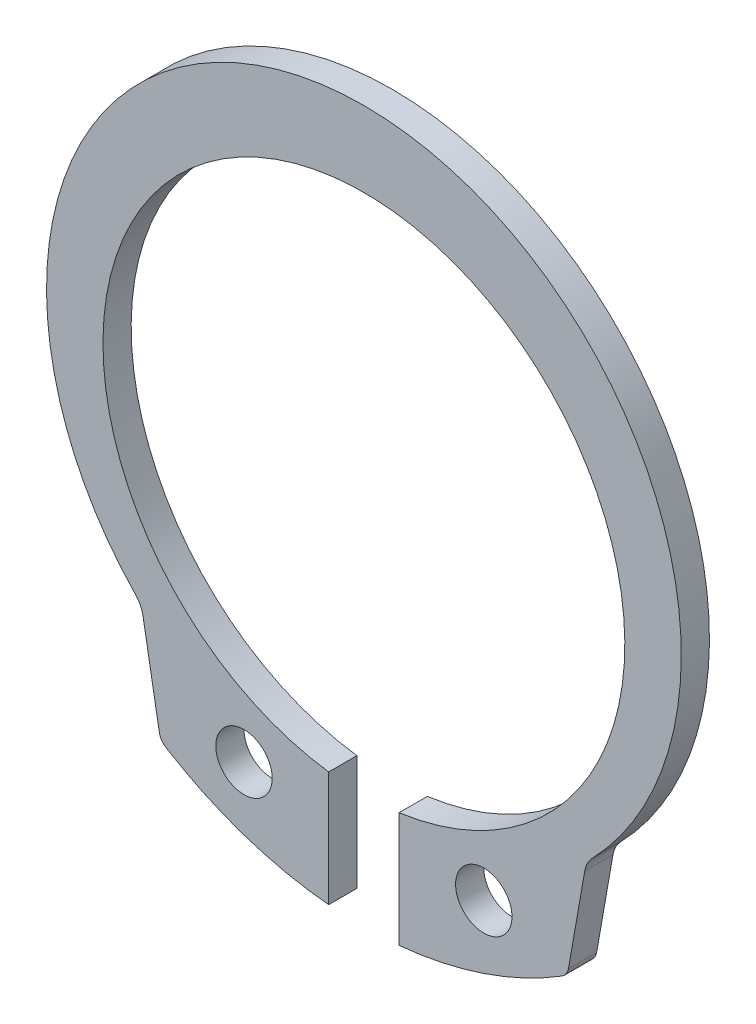
from build123d import *

# Parameters (mm, degrees)
EXTRUDE_971_DEPTH      = 0.5
EXTRUDE_971_DEPTH_BACK = 0.5
SKETCH_1_R             = 1


with BuildPart() as part:
    # 草图1 → Extrude 971 (new, two sides: drawn at the far end of the back side and taken through both)
    with BuildSketch(Plane.XY.offset(-EXTRUDE_971_DEPTH_BACK)):
        with BuildLine():
            Line((-1.25, -9.83515139), (-1.25, -13.911129106))
            ThreePointArc((-1.25, -13.911129106), (-4.248657866, -13.273130815), (-7.021564722, -11.965469395))
            ThreePointArc((-7.021564722, -11.965469395), (-7.171788127, -11.820908006), (-7.25, -11.627651777))
            Line((-7.25, -11.627651777), (-7.831163033, -8.331712432))
            ThreePointArc((-7.831163033, -8.331712432), (-7.924856006, -8.051582636), (-8.096299702, -7.811045457))
            ThreePointArc((-8.096299702, -7.811045457), (0, 11.25), (8.096299702, -7.811045457))
            ThreePointArc((8.096299702, -7.811045457), (7.924856006, -8.051582636), (7.831163033, -8.331712432))
            Line((7.831163033, -8.331712432), (7.25, -11.627651777))
            ThreePointArc((7.25, -11.627651777), (7.171788127, -11.820908006), (7.021564722, -11.965469395))
            ThreePointArc((7.021564722, -11.965469395), (4.248657866, -13.273130815), (1.25, -13.911129106))
            Line((1.25, -13.911129106), (1.25, -9.83515139))
            ThreePointArc((1.25, -9.83515139), (0, 8.58), (-1.25, -9.83515139))
        make_face()
        with Locations((-4.25, -11.032311518)):
            Circle(SKETCH_1_R, mode=Mode.SUBTRACT)
        with Locations((4.25, -11.032311518)):
            Circle(SKETCH_1_R, mode=Mode.SUBTRACT)
    extrude(amount=EXTRUDE_971_DEPTH + EXTRUDE_971_DEPTH_BACK)


solid = part.part
